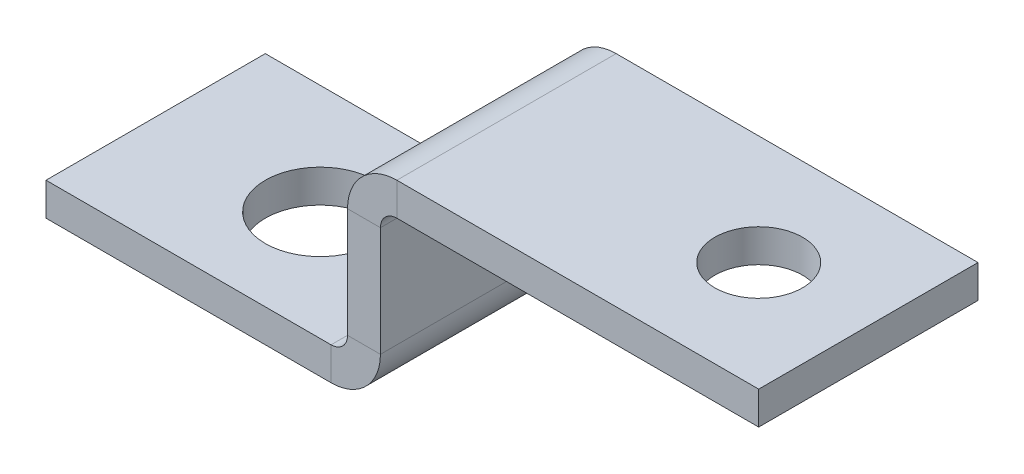
from build123d import *

# Parameters (mm, degrees)
BASE_FLANGE1_DEPTH = 10
SKETCH6_R          = 2.5
CUT_EXTRUDE1_DEPTH = 35.932076949
SKETCH7_R          = 2
CUT_EXTRUDE2_DEPTH = 36.305806888


# Sheet-metal steps are written as plain solids
with BuildPart() as part:
    # Sketch1 → Base-Flange1 (new body)
    with BuildSketch(Plane.XY):
        with BuildLine():
            Line((0, 0), (13, 0))
            ThreePointArc((13, 0), (13.530330086, 0.219669914), (13.75, 0.75))
            Line((13.75, 0.75), (13.75, 5.75))
            ThreePointArc((13.75, 5.75), (14.409009742, 7.340990258), (16, 8))
            Line((16, 8), (32.5, 8))
            Line((32.5, 8), (32.5, 6.5))
            Line((32.5, 6.5), (16, 6.5))
            ThreePointArc((16, 6.5), (15.469669914, 6.280330086), (15.25, 5.75))
            Line((15.25, 5.75), (15.25, 0.75))
            ThreePointArc((15.25, 0.75), (14.590990258, -0.840990258), (13, -1.5))
            Line((13, -1.5), (0, -1.5))
            Line((0, -1.5), (0, 0))
        make_face()
    extrude(amount=BASE_FLANGE1_DEPTH)

    # Sketch6 → Cut-Extrude1 (cut, through all)
    with BuildSketch(Plane(origin=(0, 0, 0), x_dir=(1, 0, 0), z_dir=(0, 1, 0))):
        with Locations(Location((7.5, -5, 0), (0, 0, 270))):
            Circle(SKETCH6_R)
    extrude(amount=-CUT_EXTRUDE1_DEPTH, mode=Mode.SUBTRACT)

    # Sketch7 → Cut-Extrude2 (cut, through all)
    with BuildSketch(Plane(origin=(0, 8, 0), x_dir=(1, 0, 0), z_dir=(0, 1, 0))):
        with Locations(Location((27.5, -5, 0), (0, 0, 270))):
            Circle(SKETCH7_R)
    extrude(amount=-CUT_EXTRUDE2_DEPTH, mode=Mode.SUBTRACT)


solid = part.part
